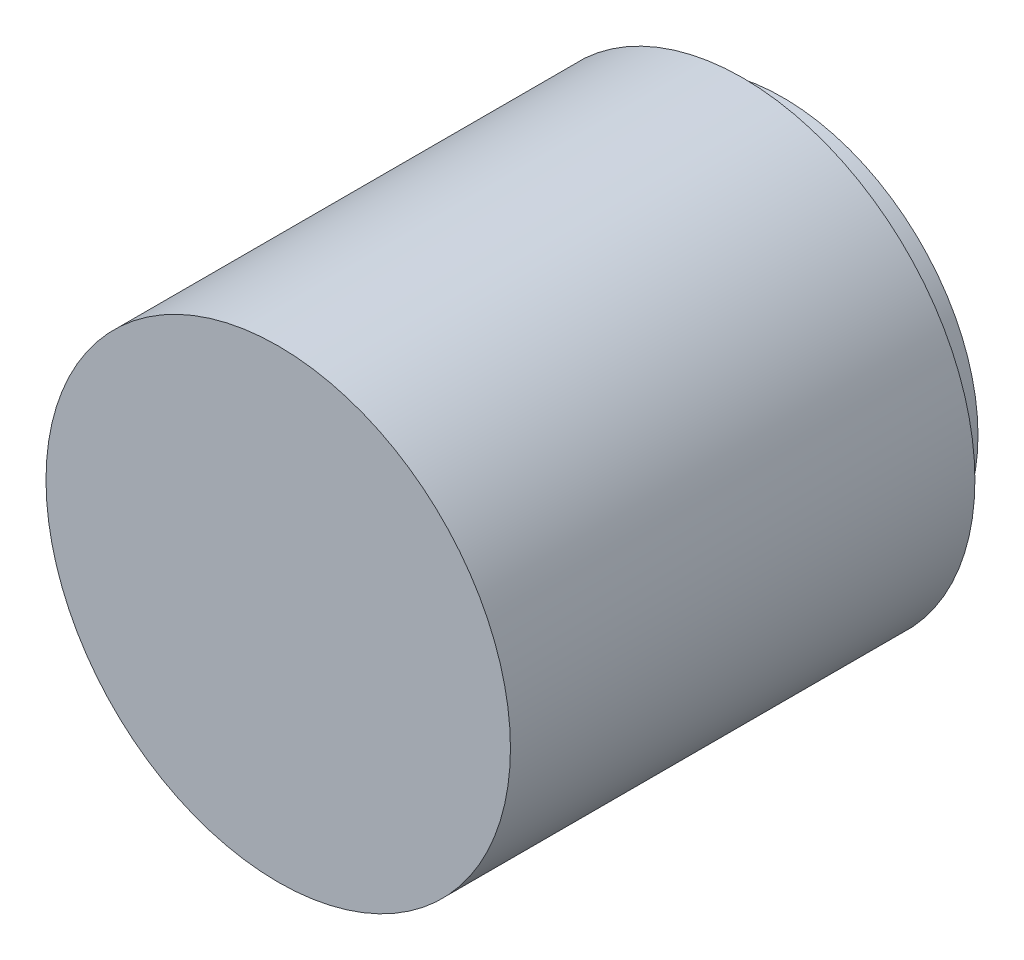
from build123d import *

# Parameters (mm, degrees)
SKETCH1_R           = 37.5
BOSS_EXTRUDE1_DEPTH = 75
SKETCH2_R           = 31.5
BOSS_EXTRUDE2_DEPTH = 6.5
SKETCH3_R           = 15.75
CUT_EXTRUDE1_DEPTH  = 6.5
SKETCH4_R           = 3
CUT_EXTRUDE2_DEPTH  = 5


with BuildPart() as part:
    # Sketch1 → Boss-Extrude1 (new body)
    with BuildSketch(Plane.XY):
        Circle(SKETCH1_R)
    extrude(amount=BOSS_EXTRUDE1_DEPTH)

    # Sketch2 → Boss-Extrude2 (add)
    with BuildSketch(Plane(origin=(0, 0, 0), x_dir=(-1, 0, 0), z_dir=(0, 0, -1))):
        Circle(SKETCH2_R)
    extrude(amount=BOSS_EXTRUDE2_DEPTH)

    # Sketch3 → Cut-Extrude1 (cut)
    with BuildSketch(Plane(origin=(0, 0, -6.5), x_dir=(-1, 0, 0), z_dir=(0, 0, -1))):
        Circle(SKETCH3_R)
    extrude(amount=-CUT_EXTRUDE1_DEPTH, mode=Mode.SUBTRACT)

    # Sketch4 → Cut-Extrude2 (cut)
    with BuildSketch(Plane(origin=(0, 0, -6.5), x_dir=(-1, 0, 0), z_dir=(0, 0, -1))):
        with Locations((25, 0)):
            Circle(SKETCH4_R)
        with Locations((0, 25)):
            Circle(SKETCH4_R)
        with Locations((0, -25)):
            Circle(SKETCH4_R)
        with Locations((-25, 0)):
            Circle(SKETCH4_R)
    extrude(amount=-CUT_EXTRUDE2_DEPTH, mode=Mode.SUBTRACT)


solid = part.part
